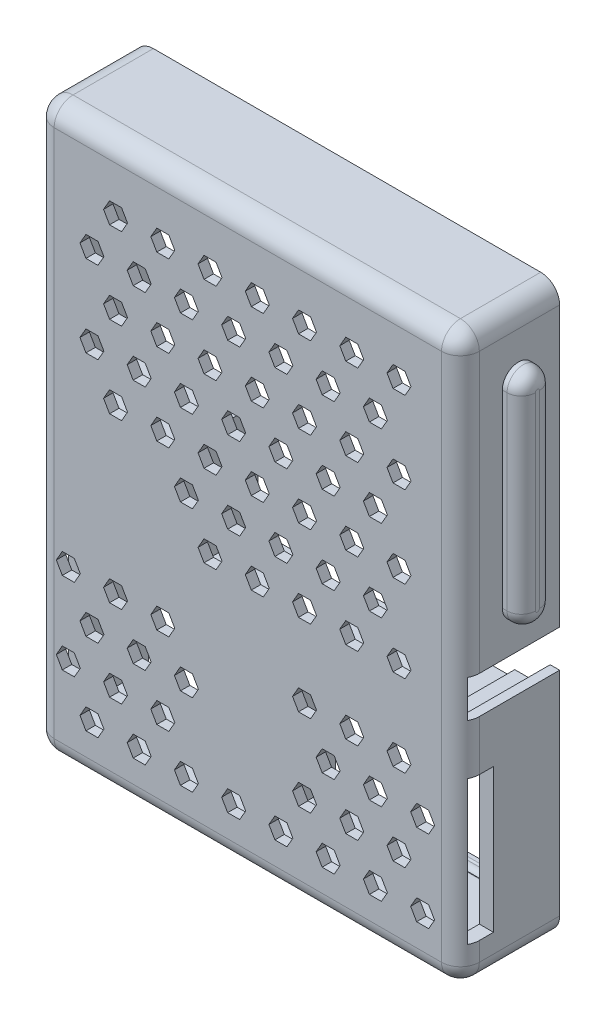
from build123d import *

# Parameters (mm, degrees)
SKETCH_1_W                = 45
SKETCH_1_H                = 60
SKETCH_1_W_2              = 17.2
SKETCH_1_H_2              = 17.2
EXTRUDE_2_DEPTH           = 8
SKETCH_2_W                = 45
SKETCH_2_H                = 60
EXTRUDE_3_DEPTH           = 1
CUT_EXTRUDE_1_DEPTH       = 8
SKETCH_4_W                = 39
SKETCH_4_H                = 25
CUT_EXTRUDE_2_DEPTH       = 8
CUT_EXTRUDE_4_DEPTH       = 8
CUT_EXTRUDE_5_REACH       = 77.538
SKETCH_6_W                = 2.5
SKETCH_6_H                = 15.2
CUT_EXTRUDE_6_DEPTH       = 1
OTHER_START               = 8
OTHER_1_DEPTH             = 1
FILLET_2_R                = 2
CUT_EXTRUDE_7_REACH       = 68.126
SKETCH_8_W                = 3.5
SKETCH_8_H                = 13.761584404
EXTRUDE_4_DEPTH           = 1.5
CUT_EXTRUDE_8_DEPTH       = 5
CUT_EXTRUDE_8_DEPTH_BACK  = 0.5
FILLET_3_R                = 0.2
CUT_EXTRUDE_13_DEPTH      = 5
CUT_EXTRUDE_13_DEPTH_BACK = 0.5
FILLET_4_R                = 0.2
EXTRUDE_5_DEPTH           = 2
FILLET_5_R                = 1.5


# Read off the part's stored shape, not the designer's step: 填充阵列1
with BuildPart() as part:
    # 草图1 → 凸台-拉伸2 (new body)
    with BuildSketch(Plane.XY):
        with Locations((-22.5, -30)):
            Rectangle(SKETCH_1_W, SKETCH_1_H)
        with Locations((-10.1, -48.4)):
            Rectangle(SKETCH_1_W_2, SKETCH_1_H_2, mode=Mode.SUBTRACT)
        with Locations((-34.9, -48.4)):
            Rectangle(SKETCH_1_W_2, SKETCH_1_H_2, mode=Mode.SUBTRACT)
    extrude(amount=EXTRUDE_2_DEPTH)

    # 草图2 → 凸台-拉伸3 (add)
    with BuildSketch(Plane.XY.offset(8)):
        with Locations((-22.5, -30)):
            Rectangle(SKETCH_2_W, SKETCH_2_H)
    extrude(amount=EXTRUDE_3_DEPTH)

    # 草图3 → 切除-拉伸1 (cut)
    with BuildSketch(Plane(origin=(0, 0, 0), x_dir=(-1, 0, 0), z_dir=(0, 0, -1))):
        Polygon((1, -37.8), (4.75, -37.8), (4.75, -29.2), (1, -29.2), (1, -31.525), (0, -31.525), (0, -35.475), (1, -35.475), align=None)
    extrude(amount=-CUT_EXTRUDE_1_DEPTH, mode=Mode.SUBTRACT)

    # 草图4 → 切除-拉伸2 (cut)
    with BuildSketch(Plane(origin=(0, 0, 0), x_dir=(-1, 0, 0), z_dir=(0, 0, -1))):
        with Locations((23.5, -14.5)):
            Rectangle(SKETCH_4_W, SKETCH_4_H)
    extrude(amount=-CUT_EXTRUDE_2_DEPTH, mode=Mode.SUBTRACT)

    # 草图5 → 切除-拉伸4 (cut)
    with BuildSketch(Plane(origin=(0, 0, 0), x_dir=(-1, 0, 0), z_dir=(0, 0, -1))):
        Polygon((18.7, -57), (26.3, -57), (26.3, -52.8), (25.1, -52.8), (25.1, -39.8), (25.1, -38.6), (31.940634291, -38.6), (31.940634291, -27), (4.75, -27), (4.75, -29.2), (4.75, -38.6), (19.9, -38.6), (19.9, -39.8), (19.9, -52.8), (18.7, -52.8), align=None)
    extrude(amount=-CUT_EXTRUDE_4_DEPTH, mode=Mode.SUBTRACT)

    # 草图6 → 切除-拉伸5 (cut, up to next)
    with BuildSketch(Plane(origin=(0, 0, 0), x_dir=(0, 0, -1), z_dir=(1, 0, 0)), mode=Mode.PRIVATE) as cut_extrude_5_sk1:
        with Locations((-6.75, -48.4)):
            Rectangle(SKETCH_6_W, SKETCH_6_H)
    cut_extrude_5_tool1 = extrude(cut_extrude_5_sk1.sketch, amount=-CUT_EXTRUDE_5_REACH, mode=Mode.PRIVATE) & part.part
    cut_extrude_5 = cut_extrude_5_tool1.solids().sort_by_distance((0, -48.4, 6.75))[0]
    add(cut_extrude_5, mode=Mode.SUBTRACT)

    # 镜向1: 切除-拉伸5 across plane
    add(cut_extrude_5.mirror(Plane.ZY.offset(22.5)), mode=Mode.SUBTRACT)

    # 草图7 → 切除-拉伸6 (cut)
    with BuildSketch(Plane(origin=(0, 0, 8), x_dir=(-1, 0, 0), z_dir=(0, 0, -1))):
        Polygon((4.635085296, -53.4), (3.364914704, -53.4), (2.729829408, -54.5), (3.364914704, -55.6), (4.635085296, -55.6), (5.270170592, -54.5), align=None)
    extrude(amount=-CUT_EXTRUDE_6_DEPTH, mode=Mode.SUBTRACT)

    # 填充阵列1 outline → 填充阵列1 (cut)
    with BuildSketch(Plane.XY.offset(OTHER_START)):
        Polygon((-7.135085296, -49.069872981), (-7.770170592, -50.169872981), (-7.135085296, -51.269872981), (-5.864914704, -51.269872981), (-5.229829408, -50.169872981), (-5.864914704, -49.069872981), align=None)
        Polygon((-9.635085296, -44.739745962), (-10.270170592, -45.839745962), (-9.635085296, -46.939745962), (-8.364914704, -46.939745962), (-7.729829408, -45.839745962), (-8.364914704, -44.739745962), align=None)
        Polygon((-12.135085296, -40.409618943), (-12.770170592, -41.509618943), (-12.135085296, -42.609618943), (-10.864914704, -42.609618943), (-10.229829408, -41.509618943), (-10.864914704, -40.409618943), align=None)
        Polygon((-17.135085296, -31.749364905), (-17.770170592, -32.849364905), (-17.135085296, -33.949364905), (-15.864914704, -33.949364905), (-15.229829408, -32.849364905), (-15.864914704, -31.749364905), align=None)
        Polygon((-19.635085296, -27.419237886), (-20.270170592, -28.519237886), (-19.635085296, -29.619237886), (-18.364914704, -29.619237886), (-17.729829408, -28.519237886), (-18.364914704, -27.419237886), align=None)
        Polygon((-22.135085296, -23.089110868), (-22.770170592, -24.189110868), (-22.135085296, -25.289110868), (-20.864914704, -25.289110868), (-20.229829408, -24.189110868), (-20.864914704, -23.089110868), align=None)
        Polygon((-24.635085296, -18.758983849), (-25.270170592, -19.858983849), (-24.635085296, -20.958983849), (-23.364914704, -20.958983849), (-22.729829408, -19.858983849), (-23.364914704, -18.758983849), align=None)
        Polygon((-27.135085296, -14.42885683), (-27.770170592, -15.52885683), (-27.135085296, -16.62885683), (-25.864914704, -16.62885683), (-25.229829408, -15.52885683), (-25.864914704, -14.42885683), align=None)
        Polygon((-29.635085296, -10.098729811), (-30.270170592, -11.198729811), (-29.635085296, -12.298729811), (-28.364914704, -12.298729811), (-27.729829408, -11.198729811), (-28.364914704, -10.098729811), align=None)
        Polygon((-32.135085296, -5.768602792), (-32.770170592, -6.868602792), (-32.135085296, -7.968602792), (-30.864914704, -7.968602792), (-30.229829408, -6.868602792), (-30.864914704, -5.768602792), align=None)
        Polygon((-25.270170592, -54.5), (-24.635085296, -55.6), (-23.364914704, -55.6), (-22.729829408, -54.5), (-23.364914704, -53.4), (-24.635085296, -53.4), align=None)
        Polygon((-30.270170592, -54.5), (-29.635085296, -55.6), (-28.364914704, -55.6), (-27.729829408, -54.5), (-28.364914704, -53.4), (-29.635085296, -53.4), align=None)
        Polygon((-20.270170592, -54.5), (-19.635085296, -55.6), (-18.364914704, -55.6), (-17.729829408, -54.5), (-18.364914704, -53.4), (-19.635085296, -53.4), align=None)
        Polygon((-40.270170592, -54.5), (-39.635085296, -55.6), (-38.364914704, -55.6), (-37.729829408, -54.5), (-38.364914704, -53.4), (-39.635085296, -53.4), align=None)
        Polygon((-35.270170592, -54.5), (-34.635085296, -55.6), (-33.364914704, -55.6), (-32.729829408, -54.5), (-33.364914704, -53.4), (-34.635085296, -53.4), align=None)
        Polygon((-10.270170592, -54.5), (-9.635085296, -55.6), (-8.364914704, -55.6), (-7.729829408, -54.5), (-8.364914704, -53.4), (-9.635085296, -53.4), align=None)
        Polygon((-15.270170592, -54.5), (-14.635085296, -55.6), (-13.364914704, -55.6), (-12.729829408, -54.5), (-13.364914704, -53.4), (-14.635085296, -53.4), align=None)
        Polygon((-5.864914704, -5.768602792), (-7.135085296, -5.768602792), (-7.770170592, -6.868602792), (-7.135085296, -7.968602792), (-5.864914704, -7.968602792), (-5.229829408, -6.868602792), align=None)
        Polygon((-15.864914704, -23.089110868), (-17.135085296, -23.089110868), (-17.770170592, -24.189110868), (-17.135085296, -25.289110868), (-15.864914704, -25.289110868), (-15.229829408, -24.189110868), align=None)
        Polygon((-10.864914704, -14.42885683), (-12.135085296, -14.42885683), (-12.770170592, -15.52885683), (-12.135085296, -16.62885683), (-10.864914704, -16.62885683), (-10.229829408, -15.52885683), align=None)
        Polygon((-8.364914704, -10.098729811), (-9.635085296, -10.098729811), (-10.270170592, -11.198729811), (-9.635085296, -12.298729811), (-8.364914704, -12.298729811), (-7.729829408, -11.198729811), align=None)
        Polygon((-13.364914704, -18.758983849), (-14.635085296, -18.758983849), (-15.270170592, -19.858983849), (-14.635085296, -20.958983849), (-13.364914704, -20.958983849), (-12.729829408, -19.858983849), align=None)
        Polygon((-28.364914704, -44.739745962), (-29.635085296, -44.739745962), (-30.270170592, -45.839745962), (-29.635085296, -46.939745962), (-28.364914704, -46.939745962), (-27.729829408, -45.839745962), align=None)
        Polygon((-30.864914704, -49.069872981), (-32.135085296, -49.069872981), (-32.770170592, -50.169872981), (-32.135085296, -51.269872981), (-30.864914704, -51.269872981), (-30.229829408, -50.169872981), align=None)
        Polygon((-20.864914704, -31.749364905), (-22.135085296, -31.749364905), (-22.770170592, -32.849364905), (-22.135085296, -33.949364905), (-20.864914704, -33.949364905), (-20.229829408, -32.849364905), align=None)
        Polygon((-27.770170592, -6.868602792), (-27.135085296, -7.968602792), (-25.864914704, -7.968602792), (-25.229829408, -6.868602792), (-25.864914704, -5.768602792), (-27.135085296, -5.768602792), align=None)
        Polygon((-17.770170592, -6.868602792), (-17.135085296, -7.968602792), (-15.864914704, -7.968602792), (-15.229829408, -6.868602792), (-15.864914704, -5.768602792), (-17.135085296, -5.768602792), align=None)
        Polygon((-12.770170592, -6.868602792), (-12.135085296, -7.968602792), (-10.864914704, -7.968602792), (-10.229829408, -6.868602792), (-10.864914704, -5.768602792), (-12.135085296, -5.768602792), align=None)
        Polygon((-22.770170592, -6.868602792), (-22.135085296, -7.968602792), (-20.864914704, -7.968602792), (-20.229829408, -6.868602792), (-20.864914704, -5.768602792), (-22.135085296, -5.768602792), align=None)
        Polygon((-37.770170592, -6.868602792), (-37.135085296, -7.968602792), (-35.864914704, -7.968602792), (-35.229829408, -6.868602792), (-35.864914704, -5.768602792), (-37.135085296, -5.768602792), align=None)
        Polygon((-20.864914704, -14.42885683), (-22.135085296, -14.42885683), (-22.770170592, -15.52885683), (-22.135085296, -16.62885683), (-20.864914704, -16.62885683), (-20.229829408, -15.52885683), align=None)
        Polygon((-18.364914704, -10.098729811), (-19.635085296, -10.098729811), (-20.270170592, -11.198729811), (-19.635085296, -12.298729811), (-18.364914704, -12.298729811), (-17.729829408, -11.198729811), align=None)
        Polygon((-38.364914704, -44.739745962), (-39.635085296, -44.739745962), (-40.270170592, -45.839745962), (-39.635085296, -46.939745962), (-38.364914704, -46.939745962), (-37.729829408, -45.839745962), align=None)
        Polygon((-40.864914704, -49.069872981), (-42.135085296, -49.069872981), (-42.770170592, -50.169872981), (-42.135085296, -51.269872981), (-40.864914704, -51.269872981), (-40.229829408, -50.169872981), align=None)
        Polygon((-35.864914704, -40.409618943), (-37.135085296, -40.409618943), (-37.770170592, -41.509618943), (-37.135085296, -42.609618943), (-35.864914704, -42.609618943), (-35.229829408, -41.509618943), align=None)
        Polygon((-25.864914704, -23.089110868), (-27.135085296, -23.089110868), (-27.770170592, -24.189110868), (-27.135085296, -25.289110868), (-25.864914704, -25.289110868), (-25.229829408, -24.189110868), align=None)
        Polygon((-28.364914704, -27.419237886), (-29.635085296, -27.419237886), (-30.270170592, -28.519237886), (-29.635085296, -29.619237886), (-28.364914704, -29.619237886), (-27.729829408, -28.519237886), align=None)
        Polygon((-24.635085296, -10.098729811), (-25.270170592, -11.198729811), (-24.635085296, -12.298729811), (-23.364914704, -12.298729811), (-22.729829408, -11.198729811), (-23.364914704, -10.098729811), align=None)
        Polygon((-19.635085296, -18.758983849), (-20.270170592, -19.858983849), (-19.635085296, -20.958983849), (-18.364914704, -20.958983849), (-17.729829408, -19.858983849), (-18.364914704, -18.758983849), align=None)
        Polygon((-14.635085296, -27.419237886), (-15.270170592, -28.519237886), (-14.635085296, -29.619237886), (-13.364914704, -29.619237886), (-12.729829408, -28.519237886), (-13.364914704, -27.419237886), align=None)
        Polygon((-12.135085296, -31.749364905), (-12.770170592, -32.849364905), (-12.135085296, -33.949364905), (-10.864914704, -33.949364905), (-10.229829408, -32.849364905), (-10.864914704, -31.749364905), align=None)
        Polygon((-4.635085296, -44.739745962), (-5.270170592, -45.839745962), (-4.635085296, -46.939745962), (-3.364914704, -46.939745962), (-2.729829408, -45.839745962), (-3.364914704, -44.739745962), align=None)
        Polygon((-7.135085296, -40.409618943), (-7.770170592, -41.509618943), (-7.135085296, -42.609618943), (-5.864914704, -42.609618943), (-5.229829408, -41.509618943), (-5.864914704, -40.409618943), align=None)
        Polygon((-7.770170592, -15.52885683), (-7.135085296, -16.62885683), (-5.864914704, -16.62885683), (-5.229829408, -15.52885683), (-5.864914704, -14.42885683), (-7.135085296, -14.42885683), align=None)
        Polygon((-17.770170592, -15.52885683), (-17.135085296, -16.62885683), (-15.864914704, -16.62885683), (-15.229829408, -15.52885683), (-15.864914704, -14.42885683), (-17.135085296, -14.42885683), align=None)
        Polygon((-37.770170592, -15.52885683), (-37.135085296, -16.62885683), (-35.864914704, -16.62885683), (-35.229829408, -15.52885683), (-35.864914704, -14.42885683), (-37.135085296, -14.42885683), align=None)
        Polygon((-32.770170592, -15.52885683), (-32.135085296, -16.62885683), (-30.864914704, -16.62885683), (-30.229829408, -15.52885683), (-30.864914704, -14.42885683), (-32.135085296, -14.42885683), align=None)
        Polygon((-40.864914704, -40.409618943), (-42.135085296, -40.409618943), (-42.770170592, -41.509618943), (-42.135085296, -42.609618943), (-40.864914704, -42.609618943), (-40.229829408, -41.509618943), align=None)
        Polygon((-28.364914704, -18.758983849), (-29.635085296, -18.758983849), (-30.270170592, -19.858983849), (-29.635085296, -20.958983849), (-28.364914704, -20.958983849), (-27.729829408, -19.858983849), align=None)
        Polygon((-30.864914704, -23.089110868), (-32.135085296, -23.089110868), (-32.770170592, -24.189110868), (-32.135085296, -25.289110868), (-30.864914704, -25.289110868), (-30.229829408, -24.189110868), align=None)
        Polygon((-15.270170592, -11.198729811), (-14.635085296, -12.298729811), (-13.364914704, -12.298729811), (-12.729829408, -11.198729811), (-13.364914704, -10.098729811), (-14.635085296, -10.098729811), align=None)
        Polygon((-40.270170592, -11.198729811), (-39.635085296, -12.298729811), (-38.364914704, -12.298729811), (-37.729829408, -11.198729811), (-38.364914704, -10.098729811), (-39.635085296, -10.098729811), align=None)
        Polygon((-35.270170592, -11.198729811), (-34.635085296, -12.298729811), (-33.364914704, -12.298729811), (-32.729829408, -11.198729811), (-33.364914704, -10.098729811), (-34.635085296, -10.098729811), align=None)
        Polygon((-35.864914704, -23.089110868), (-37.135085296, -23.089110868), (-37.770170592, -24.189110868), (-37.135085296, -25.289110868), (-35.864914704, -25.289110868), (-35.229829408, -24.189110868), align=None)
        Polygon((-33.364914704, -18.758983849), (-34.635085296, -18.758983849), (-35.270170592, -19.858983849), (-34.635085296, -20.958983849), (-33.364914704, -20.958983849), (-32.729829408, -19.858983849), align=None)
        Polygon((-37.770170592, -50.169872981), (-37.135085296, -51.269872981), (-35.864914704, -51.269872981), (-35.229829408, -50.169872981), (-35.864914704, -49.069872981), (-37.135085296, -49.069872981), align=None)
        Polygon((-12.770170592, -50.169872981), (-12.135085296, -51.269872981), (-10.864914704, -51.269872981), (-10.229829408, -50.169872981), (-10.864914704, -49.069872981), (-12.135085296, -49.069872981), align=None)
        Polygon((-17.770170592, -50.169872981), (-17.135085296, -51.269872981), (-15.864914704, -51.269872981), (-15.229829408, -50.169872981), (-15.864914704, -49.069872981), (-17.135085296, -49.069872981), align=None)
        Polygon((-30.864914704, -40.409618943), (-32.135085296, -40.409618943), (-32.770170592, -41.509618943), (-32.135085296, -42.609618943), (-30.864914704, -42.609618943), (-30.229829408, -41.509618943), align=None)
        Polygon((-33.364914704, -44.739745962), (-34.635085296, -44.739745962), (-35.270170592, -45.839745962), (-34.635085296, -46.939745962), (-33.364914704, -46.939745962), (-32.729829408, -45.839745962), align=None)
        Polygon((-23.364914704, -27.419237886), (-24.635085296, -27.419237886), (-25.270170592, -28.519237886), (-24.635085296, -29.619237886), (-23.364914704, -29.619237886), (-22.729829408, -28.519237886), align=None)
        Polygon((-25.864914704, -31.749364905), (-27.135085296, -31.749364905), (-27.770170592, -32.849364905), (-27.135085296, -33.949364905), (-25.864914704, -33.949364905), (-25.229829408, -32.849364905), align=None)
        Polygon((-10.270170592, -19.858983849), (-9.635085296, -20.958983849), (-8.364914704, -20.958983849), (-7.729829408, -19.858983849), (-8.364914704, -18.758983849), (-9.635085296, -18.758983849), align=None)
        Polygon((-40.270170592, -19.858983849), (-39.635085296, -20.958983849), (-38.364914704, -20.958983849), (-37.729829408, -19.858983849), (-38.364914704, -18.758983849), (-39.635085296, -18.758983849), align=None)
        Polygon((-7.770170592, -24.189110868), (-7.135085296, -25.289110868), (-5.864914704, -25.289110868), (-5.229829408, -24.189110868), (-5.864914704, -23.089110868), (-7.135085296, -23.089110868), align=None)
        Polygon((-12.770170592, -24.189110868), (-12.135085296, -25.289110868), (-10.864914704, -25.289110868), (-10.229829408, -24.189110868), (-10.864914704, -23.089110868), (-12.135085296, -23.089110868), align=None)
        Polygon((-10.270170592, -28.519237886), (-9.635085296, -29.619237886), (-8.364914704, -29.619237886), (-7.729829408, -28.519237886), (-8.364914704, -27.419237886), (-9.635085296, -27.419237886), align=None)
        Polygon((-15.864914704, -40.409618943), (-17.135085296, -40.409618943), (-17.770170592, -41.509618943), (-17.135085296, -42.609618943), (-15.864914704, -42.609618943), (-15.229829408, -41.509618943), align=None)
        Polygon((-7.770170592, -32.849364905), (-7.135085296, -33.949364905), (-5.864914704, -33.949364905), (-5.229829408, -32.849364905), (-5.864914704, -31.749364905), (-7.135085296, -31.749364905), align=None)
        Polygon((-15.270170592, -45.839745962), (-14.635085296, -46.939745962), (-13.364914704, -46.939745962), (-12.729829408, -45.839745962), (-13.364914704, -44.739745962), (-14.635085296, -44.739745962), align=None)
    extrude(amount=OTHER_1_DEPTH, mode=Mode.SUBTRACT)

    # 圆角2
    # the kernel refuses this fillet: 2 mm, written as the material it takes off along each edge
    with BuildSketch(Plane(origin=(-2, -2, 7), x_dir=(1, 0, 0), z_dir=(0, 1, 0))) as fillet_2_piece_1_section:
        Polygon((0, 0), (FILLET_2_R, 0), (FILLET_2_R, -FILLET_2_R), (0, -FILLET_2_R), align=None)
    fillet_2_piece_1 = extrude(amount=FILLET_2_R, mode=Mode.PRIVATE)
    fillet_2_piece_1 = fillet_2_piece_1 - Plane(origin=(-2, -2, 7), x_dir=(-0.7071067811865475, 0, -0.7071067811865475), z_dir=(0, 1, 0)) * Sphere(FILLET_2_R, mode=Mode.PRIVATE)
    add(fillet_2_piece_1, mode=Mode.SUBTRACT)
    with BuildSketch(Plane(origin=(-43, -2, 7), x_dir=(0, 0, 1), z_dir=(0, 1, 0))) as fillet_2_piece_2_section:
        Polygon((0, 0), (FILLET_2_R, 0), (FILLET_2_R, -FILLET_2_R), (0, -FILLET_2_R), align=None)
    fillet_2_piece_2 = extrude(amount=FILLET_2_R, mode=Mode.PRIVATE)
    fillet_2_piece_2 = fillet_2_piece_2 - Plane(origin=(-43, -2, 7), x_dir=(0.7071067811865475, 0, -0.7071067811865475), z_dir=(0, 1, 0)) * Sphere(FILLET_2_R, mode=Mode.PRIVATE)
    add(fillet_2_piece_2, mode=Mode.SUBTRACT)
    with BuildSketch(Plane(origin=(-43, -58, 7), x_dir=(-1, 0, 0), z_dir=(0, 0, 1))) as fillet_2_piece_3_section:
        Polygon((0, 0), (FILLET_2_R, 0), (FILLET_2_R, FILLET_2_R), (0, FILLET_2_R), align=None)
    fillet_2_piece_3 = extrude(amount=FILLET_2_R, mode=Mode.PRIVATE)
    fillet_2_piece_3 = fillet_2_piece_3 - Plane(origin=(-43, -58, 7), x_dir=(0.7071067811865474, 0.7071067811865477, 0), z_dir=(0, 0, 1)) * Sphere(FILLET_2_R, mode=Mode.PRIVATE)
    add(fillet_2_piece_3, mode=Mode.SUBTRACT)
    with BuildSketch(Plane(origin=(-2, -58, 7), x_dir=(0, 0, 1), z_dir=(1, 0, 0))) as fillet_2_piece_4_section:
        Polygon((0, 0), (FILLET_2_R, 0), (FILLET_2_R, FILLET_2_R), (0, FILLET_2_R), align=None)
    fillet_2_piece_4 = extrude(amount=FILLET_2_R, mode=Mode.PRIVATE)
    fillet_2_piece_4 = fillet_2_piece_4 - Plane(origin=(-2, -58, 7), x_dir=(0, 0.7071067811865475, -0.7071067811865475), z_dir=(1, 0, 0)) * Sphere(FILLET_2_R, mode=Mode.PRIVATE)
    add(fillet_2_piece_4, mode=Mode.SUBTRACT)
    with BuildSketch(Plane(origin=(-2, 0, 9), x_dir=(0, 0, -1), z_dir=(-1, 0, 0))) as fillet_2_piece_5:
        with BuildLine():
            CenterArc((FILLET_2_R, FILLET_2_R), FILLET_2_R, 180, 90)
            Line((0, FILLET_2_R), (0, 0))
            Line((0, 0), (FILLET_2_R, 0))
        make_face()
    extrude(amount=41, mode=Mode.SUBTRACT)
    with BuildSketch(Plane(origin=(-45, -2, 9), x_dir=(1, 0, 0), z_dir=(0, -1, 0))) as fillet_2_piece_6:
        with BuildLine():
            CenterArc((FILLET_2_R, -FILLET_2_R), FILLET_2_R, 90, 90)
            Line((0, -FILLET_2_R), (0, 0))
            Line((0, 0), (FILLET_2_R, 0))
        make_face()
    extrude(amount=56, mode=Mode.SUBTRACT)
    with BuildSketch(Plane(origin=(-43, -60, 9), x_dir=(0, 1, 0), z_dir=(1, 0, 0))) as fillet_2_piece_7:
        with BuildLine():
            CenterArc((FILLET_2_R, -FILLET_2_R), FILLET_2_R, 90, 90)
            Line((0, -FILLET_2_R), (0, 0))
            Line((0, 0), (FILLET_2_R, 0))
        make_face()
    extrude(amount=41, mode=Mode.SUBTRACT)
    with BuildSketch(Plane(origin=(0, -58, 9), x_dir=(0, 0, -1), z_dir=(0, 1, 0))) as fillet_2_piece_8:
        with BuildLine():
            CenterArc((FILLET_2_R, FILLET_2_R), FILLET_2_R, 180, 90)
            Line((0, FILLET_2_R), (0, 0))
            Line((0, 0), (FILLET_2_R, 0))
        make_face()
    extrude(amount=56, mode=Mode.SUBTRACT)
    with BuildSketch(Plane(origin=(0, -60, 7), x_dir=(0, 1, 0), z_dir=(0, 0, -1)), Plane(origin=(-45, -60, -5), x_dir=(0, 1, 0), z_dir=(0, 0, 1)), Plane(origin=(-45, 0, -5), x_dir=(1, 0, 0), z_dir=(0, 0, 1)), Plane(origin=(0, 0, 7), x_dir=(-1, 0, 0), z_dir=(0, 0, -1))) as fillet_2_piece_9:
        with BuildLine():
            CenterArc((FILLET_2_R, -FILLET_2_R), FILLET_2_R, 90, 90)
            Line((0, -FILLET_2_R), (0, 0))
            Line((0, 0), (FILLET_2_R, 0))
        make_face()
    extrude(amount=12, mode=Mode.SUBTRACT)

    # 切除-拉伸7: up to this face of the body (flat: up to its plane)
    cut_extrude_7_end = Plane(part.part.faces().sort_by_distance((-18.7, -46.3, 4))[0])
    # 草图8 → 切除-拉伸7 (cut, up to the picked face)
    with BuildSketch(Plane.ZY.offset(26.3), mode=Mode.PRIVATE) as cut_extrude_7_sk1:
        with Locations((1.75, -46.680792202)):
            Rectangle(SKETCH_8_W, SKETCH_8_H)
    cut_extrude_7_tool1 = split(extrude(cut_extrude_7_sk1.sketch, amount=-CUT_EXTRUDE_7_REACH, mode=Mode.PRIVATE), bisect_by=cut_extrude_7_end, keep=Keep.BOTH, mode=Mode.PRIVATE)
    add(cut_extrude_7_tool1.solids().sort_by(Axis((-26.3, -46.680792, 1.75), (1, 0, 0)))[0], mode=Mode.SUBTRACT)

    # 草图9 → 凸台-拉伸4 (add)
    with BuildSketch(Plane(origin=(0, 0, 0), x_dir=(-1, 0, 0), z_dir=(0, 0, -1))):
        with BuildLine():
            Line((25.1, -38.6), (25.1, -39.8))
            Line((25.1, -39.8), (43.5, -39.8))
            Line((43.5, -39.8), (43.5, -57))
            Line((43.5, -57), (1.5, -57))
            Line((1.5, -57), (1.5, -39.8))
            Line((1.5, -39.8), (19.9, -39.8))
            Line((19.9, -39.8), (19.9, -38.6))
            Line((19.9, -38.6), (4.75, -38.6))
            Line((4.75, -38.6), (4.75, -37.8))
            Line((4.75, -37.8), (1, -37.8))
            Line((1, -37.8), (1, -35.475))
            Line((1, -35.475), (0, -35.475))
            Line((0, -35.475), (0, -58))
            ThreePointArc((0, -58), (0.585786438, -59.414213562), (2, -60))
            Line((2, -60), (43, -60))
            ThreePointArc((43, -60), (44.414213562, -59.414213562), (45, -58))
            Line((45, -58), (45, -2))
            ThreePointArc((45, -2), (44.414213562, -0.585786438), (43, 0))
            Line((43, 0), (2, 0))
            ThreePointArc((2, 0), (0.585786438, -0.585786438), (0, -2))
            Line((0, -2), (0, -31.525))
            Line((0, -31.525), (1, -31.525))
            Line((1, -31.525), (1, -29.2))
            Line((1, -29.2), (4.75, -29.2))
            Line((4.75, -29.2), (4.75, -27))
            Line((4.75, -27), (4, -27))
            Line((4, -27), (4, -2))
            Line((4, -2), (43, -2))
            Line((43, -2), (43, -27))
            Line((43, -27), (31.940634291, -27))
            Line((31.940634291, -27), (31.940634291, -38.6))
            Line((31.940634291, -38.6), (25.1, -38.6))
        make_face()
    extrude(amount=EXTRUDE_4_DEPTH)

    # 草图11 → 切除-拉伸8 (cut, two sides: drawn at the far end of the back side and taken through both)
    with BuildSketch(Plane.ZY.offset(7).offset(-CUT_EXTRUDE_8_DEPTH_BACK)):
        with BuildLine():
            Line((-0.9, -57), (0.2, -57))
            ThreePointArc((0.2, -57), (-0.35, -57.55), (-0.9, -57))
        make_face()
    extrude(amount=CUT_EXTRUDE_8_DEPTH + CUT_EXTRUDE_8_DEPTH_BACK, mode=Mode.SUBTRACT)

    # 圆角3
    fillet_3_edges = [part.edges().sort_by_distance(p)[0] for p in [
        (-9.25, -57, -0.9),
        (-9.25, -57, 0.2),
    ]]
    fillet(fillet_3_edges, radius=FILLET_3_R)

    # 草图12 → 切除-拉伸13 (cut, two sides: drawn at the far end of the back side and taken through both)
    with BuildSketch(Plane(origin=(-38, 0, 0), x_dir=(0, 0, -1), z_dir=(1, 0, 0)).offset(-CUT_EXTRUDE_13_DEPTH_BACK)):
        with BuildLine():
            Line((-0.2, -39.8), (0.9, -39.8))
            ThreePointArc((0.9, -39.8), (0.35, -39.25), (-0.2, -39.8))
        make_face()
    extrude(amount=CUT_EXTRUDE_13_DEPTH + CUT_EXTRUDE_13_DEPTH_BACK, mode=Mode.SUBTRACT)

    # 圆角4
    fillet_4_edges = [part.edges().sort_by_distance(p)[0] for p in [
        (-35.75, -39.8, -0.9),
        (-35.75, -39.8, 0.2),
    ]]
    fillet(fillet_4_edges, radius=FILLET_4_R)

    # 草图13 → 凸台-拉伸5 (add)
    with BuildSketch(Plane(origin=(0, 0, 0), x_dir=(0, 0, -1), z_dir=(1, 0, 0))):
        with BuildLine():
            Line((-1.139920557, -6.7625), (-1.139920557, -26.7625))
            ThreePointArc((-1.139920557, -26.7625), (-2.852952325, -28.475531769), (-4.565984094, -26.7625))
            Line((-4.565984094, -26.7625), (-4.565984094, -6.7625))
            ThreePointArc((-4.565984094, -6.7625), (-2.852952325, -5.049468231), (-1.139920557, -6.7625))
        make_face()
    extrude(amount=EXTRUDE_5_DEPTH)

    # 圆角5
    fillet_5_edges = [part.edges().sort_by_distance(p)[0] for p in [
        (2, -16.7625, 1.139920557),
        (2, -5.049468231, 2.852952325),
        (2, -16.7625, 4.565984094),
        (2, -28.475531769, 2.852952325),
    ]]
    fillet(fillet_5_edges, radius=FILLET_5_R)


solid = part.part
